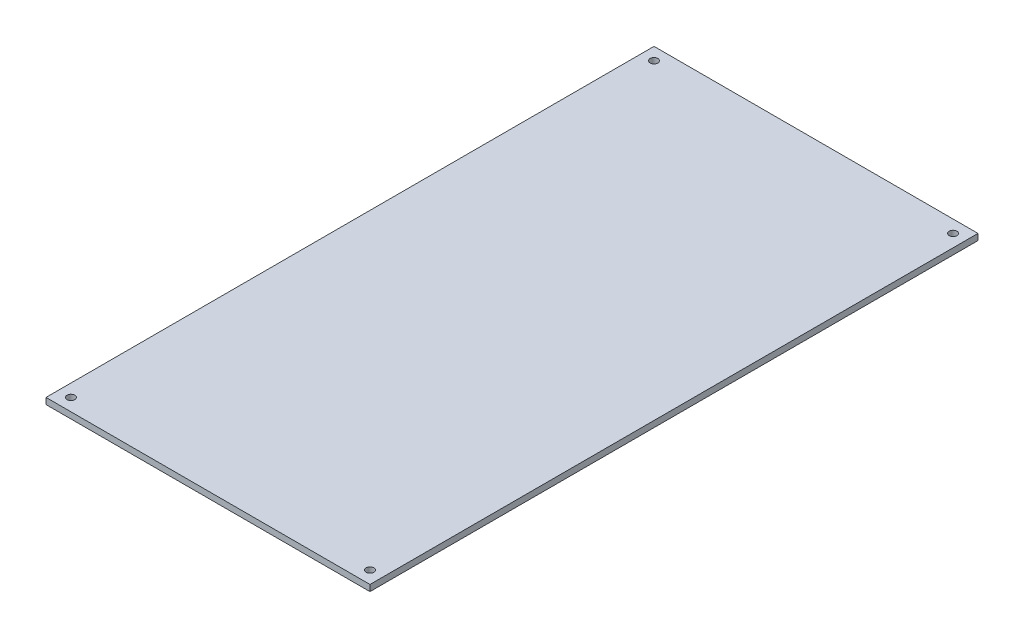
from build123d import *

# Parameters (mm, degrees)
SKETCH1_W           = 330.200000004
SKETCH1_H           = 619.700000498
SKETCH1_R           = 3.96875
BOSS_EXTRUDE1_DEPTH = 6.35


with BuildPart() as part:
    # Sketch1 → Boss-Extrude1 (new body)
    with BuildSketch(Plane(origin=(0, -91.897200465, 0), x_dir=(1, 0, 0), z_dir=(0, 1, 0))):
        with Locations((-634.09999992, 316.295249784)):
            Rectangle(SKETCH1_W, SKETCH1_H)
        with Locations((-481.699999947, 613.44525004)):
            Circle(SKETCH1_R, mode=Mode.SUBTRACT)
        with Locations((-786.499999947, 613.445250033)):
            Circle(SKETCH1_R, mode=Mode.SUBTRACT)
        with Locations((-786.499999922, 19.145249535)):
            Circle(SKETCH1_R, mode=Mode.SUBTRACT)
        with Locations((-481.699999918, 19.14525)):
            Circle(SKETCH1_R, mode=Mode.SUBTRACT)
    extrude(amount=BOSS_EXTRUDE1_DEPTH)


solid = part.part
